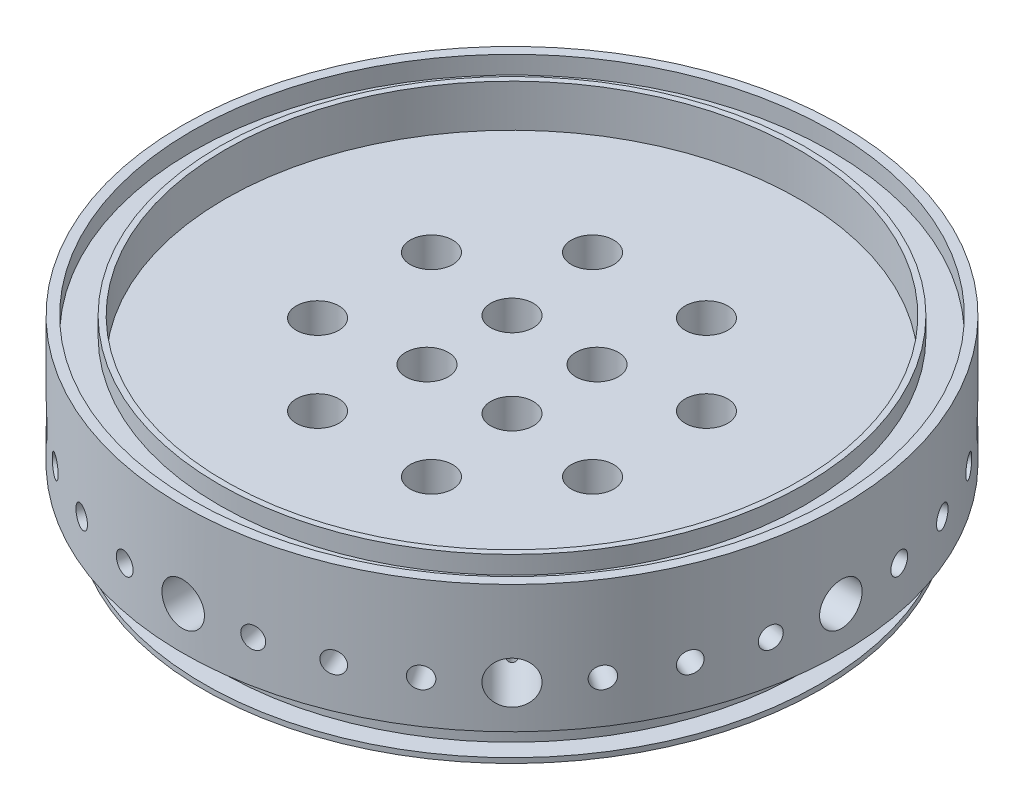
from build123d import *

# Parameters (mm, degrees)
CIRPATTERN9_COUNT  = 32
CIRPATTERN1_COUNT  = 8
CIRPATTERN2_COUNT  = 8
CIRPATTERN3_COUNT  = 4
CIRPATTERN4_COUNT  = 4
CIRPATTERN5_COUNT  = 8
CIRPATTERN6_COUNT  = 32
CIRPATTERN10_COUNT = 8
CIRPATTERN7_COUNT  = 4
CIRPATTERN8_COUNT  = 8


with BuildPart() as part:
    # Sketch1 → Revolve1 (revolve)
    with BuildSketch(Plane.XY):
        Polygon((0, 0), (-46.0375, 0), (-46.0375, 0.75565), (-43.2181, 0.75565), (-43.2181, 5.55625), (-46.0375, 5.55625), (-46.0375, 6.35), (-49.2125, 6.35), (-49.2125, 25.4), (-47.7774, 25.4), (-47.7774, 22.7076), (-43.7134, 22.7076), (-43.7134, 25.4), (-42.8625, 25.4), (-42.8625, 19.05), (0, 19.05), align=None)
    revolve(axis=Axis((0, 19.05, 0), (0, -1, 0)))

    # Sketch37 → 1/8 (0.125) Diameter Hole2 (revolve, cut)
    with BuildSketch(Plane(origin=(49.2125, 12.7, 0), x_dir=(0, 0, -1), z_dir=(0, 1, 0))):
        Polygon((0, 0), (0, 13.653866233), (1.5875, 12.7), (1.5875, 0), align=None)
    f_1_8_0_125_diameter_hole2 = revolve(axis=Axis((55.5625, 12.7, 0), (-1, 0, 0)), mode=Mode.SUBTRACT)

    # CirPattern9: 1/8 (0.125) Diameter Hole2 ×32 about axis
    cirpattern9_axis = Axis((0, -42.3, 0), (0, 1, 0))
    for i in range(1, CIRPATTERN9_COUNT):
        add(f_1_8_0_125_diameter_hole2.rotate(cirpattern9_axis, i * 360 / CIRPATTERN9_COUNT), mode=Mode.SUBTRACT)

    # Sketch13 → 1/4 (0.25) Diameter Hole1 (revolve, cut)
    with BuildSketch(Plane(origin=(49.2125, 12.7, 0), x_dir=(0, 0, -1), z_dir=(0, 1, 0))):
        Polygon((0, 0), (0, 14.607732465), (3.175, 12.7), (3.175, 0), align=None)
    f_1_4_0_25_diameter_hole1 = revolve(axis=Axis((55.5625, 12.7, 0), (-1, 0, 0)), mode=Mode.SUBTRACT)

    # Sketch15 → 3/16 (0.1875) Diameter Hole1 (revolve, cut)
    with BuildSketch(Plane(origin=(49.2125, 12.7, 0), x_dir=(0, 0, -1), z_dir=(0, 1, 0))):
        Polygon((0, 0), (0, 33.180799349), (2.38125, 31.75), (2.38125, 0), align=None)
    f_3_16_0_1875_diameter_hole1 = revolve(axis=Axis((55.5625, 12.7, 0), (-1, 0, 0)), mode=Mode.SUBTRACT)

    # Sketch17 → 1/8 (0.125) Diameter Hole1 (revolve, cut)
    with BuildSketch(Plane(origin=(49.2125, 12.7, 0), x_dir=(0, 0, -1), z_dir=(0, 1, 0))):
        Polygon((0, 0), (0, 45.403866233), (1.5875, 44.45), (1.5875, 0), align=None)
    f_1_8_0_125_diameter_hole1 = revolve(axis=Axis((55.5625, 12.7, 0), (-1, 0, 0)), mode=Mode.SUBTRACT)

    # CirPattern1: 1/4 (0.25) Diameter Hole1 ×8 about axis
    cirpattern1_axis = Axis((0, -42.3, 0), (0, 1, 0))
    for i in range(1, CIRPATTERN1_COUNT):
        add(f_1_4_0_25_diameter_hole1.rotate(cirpattern1_axis, i * 360 / CIRPATTERN1_COUNT), mode=Mode.SUBTRACT)

    # CirPattern2: 3/16 (0.1875) Diameter Hole1 ×8 about axis
    cirpattern2_axis = Axis((0, -42.3, 0), (0, 1, 0))
    for i in range(1, CIRPATTERN2_COUNT):
        add(f_3_16_0_1875_diameter_hole1.rotate(cirpattern2_axis, i * 360 / CIRPATTERN2_COUNT), mode=Mode.SUBTRACT)

    # CirPattern3: 1/8 (0.125) Diameter Hole1 ×4 about axis
    cirpattern3_axis = Axis((0, -42.3, 0), (0, 1, 0))
    for i in range(1, CIRPATTERN3_COUNT):
        add(f_1_8_0_125_diameter_hole1.rotate(cirpattern3_axis, i * 360 / CIRPATTERN3_COUNT), mode=Mode.SUBTRACT)

    # Sketch20 → inner large LOX holes (revolve, cut)
    with BuildSketch(Plane(origin=(-6.35, 19.05, 6.35), x_dir=(0, 0, 1), z_dir=(1, 0, 0))):
        Polygon((0, 0), (0, 14.607732465), (3.175, 12.7), (3.175, 0), align=None)
    inner_large_lox_holes = revolve(axis=Axis((-6.35, 25.4, 6.35), (0, -1, 0)), mode=Mode.SUBTRACT)

    # Sketch22 → outer large LOX hole (revolve, cut)
    with BuildSketch(Plane(origin=(-20.53322261, 19.05, 8.505139284), x_dir=(0, 0, 1), z_dir=(1, 0, 0))):
        Polygon((0, 0), (0, 14.607732465), (3.175, 12.7), (3.175, 0), align=None)
    outer_large_lox_hole = revolve(axis=Axis((-20.53322261, 25.4, 8.505139284), (0, -1, 0)), mode=Mode.SUBTRACT)

    # CirPattern4: inner large LOX holes ×4 about axis
    cirpattern4_axis = Axis((0, -42.3, 0), (0, 1, 0))
    for i in range(1, CIRPATTERN4_COUNT):
        add(inner_large_lox_holes.rotate(cirpattern4_axis, i * 360 / CIRPATTERN4_COUNT), mode=Mode.SUBTRACT)

    # CirPattern5: outer large LOX hole ×8 about axis
    cirpattern5_axis = Axis((0, -42.3, 0), (0, 1, 0))
    for i in range(1, CIRPATTERN5_COUNT):
        add(outer_large_lox_hole.rotate(cirpattern5_axis, i * 360 / CIRPATTERN5_COUNT), mode=Mode.SUBTRACT)

    # Sketch26 → film cooling holes (revolve, cut)
    with BuildSketch(Plane(origin=(-41.413359742, -1.581459083, 0), x_dir=(0.9961946980917455, -0.08715574274765836, 0), z_dir=(0, 0, 1))):
        Polygon((0, 0), (0, 12.871695922), (0.28575, 12.7), (0.28575, 0), align=None)
    film_cooling_holes = revolve(axis=Axis((-41.966798708, -7.907295416, 0), (0.08715574274765835, 0.9961946980917455, 0)), mode=Mode.SUBTRACT)

    # CirPattern6: film cooling holes ×32 about axis
    cirpattern6_axis = Axis((0, -42.3, 0), (0, 1, 0))
    for i in range(1, CIRPATTERN6_COUNT):
        add(film_cooling_holes.rotate(cirpattern6_axis, i * 360 / CIRPATTERN6_COUNT), mode=Mode.SUBTRACT)

    # Sketch39 → 3/64 (0.04688) Diameter Hole1 (revolve, cut)
    with BuildSketch(Plane(origin=(-41.413359742, -1.581459083, 0), x_dir=(0.9961946980917455, -0.08715574274765836, 0), z_dir=(0, 0, 1))):
        Polygon((0, 0), (0, 13.057737992), (0.595376, 12.7), (0.595376, 0), align=None)
    f_3_64_0_04688_diameter_hole1 = revolve(axis=Axis((-41.966798708, -7.907295416, 0), (0.08715574274765835, 0.9961946980917455, 0)), mode=Mode.SUBTRACT)

    # CirPattern10: 3/64 (0.04688) Diameter Hole1 ×8 about axis
    cirpattern10_axis = Axis((0, -42.3, 0), (0, 1, 0))
    for i in range(1, CIRPATTERN10_COUNT):
        add(f_3_64_0_04688_diameter_hole1.rotate(cirpattern10_axis, i * 360 / CIRPATTERN10_COUNT), mode=Mode.SUBTRACT)

    # Sketch28 → 1/16 (0.0625) Diameter Hole2 (revolve, cut)
    with BuildSketch(Plane(origin=(-6.35, 0, 0), x_dir=(0, 0, -1), z_dir=(1, 0, 0))):
        Polygon((0, 0), (0, 13.176933116), (0.79375, 12.7), (0.79375, 0), align=None)
    f_1_16_0_0625_diameter_hole2 = revolve(axis=Axis((-6.35, -6.35, 0), (0, 1, 0)), mode=Mode.SUBTRACT)

    # Sketch30 → 1/16 (0.0625) Diameter Hole1 (revolve, cut)
    with BuildSketch(Plane(origin=(-6.35, -6.35, 0), x_dir=(0, 0.500000000000001, -0.866025403784438), z_dir=(1, 0, 0))):
        Polygon((0, 0), (0, 16.097933116), (0.79375, 15.621), (0.79375, 0), align=None)
    f_1_16_0_0625_diameter_hole1 = revolve(axis=Axis((-6.35, -11.849261314, -3.175), (0, 0.866025403784438, 0.500000000000001)), mode=Mode.SUBTRACT)

    # Sketch33 → 1/16 (0.0625) Diameter Hole3 (revolve, cut)
    with BuildSketch(Plane(origin=(-22.225, 0, 0), x_dir=(0, 0, -1), z_dir=(1, 0, 0))):
        Polygon((0, 0), (0, 13.176933116), (0.79375, 12.7), (0.79375, 0), align=None)
    f_1_16_0_0625_diameter_hole3 = revolve(axis=Axis((-22.225, -6.35, 0), (0, 1, 0)), mode=Mode.SUBTRACT)

    # Sketch35 → 1/16 (0.0625) Diameter Hole4 (revolve, cut)
    with BuildSketch(Plane(origin=(-22.225, -6.35, 0), x_dir=(0, 0.500000000000001, -0.866025403784438), z_dir=(1, 0, 0))):
        Polygon((0, 0), (0, 19.526933116), (0.79375, 19.05), (0.79375, 0), align=None)
    f_1_16_0_0625_diameter_hole4 = revolve(axis=Axis((-22.225, -11.849261314, -3.175), (0, 0.866025403784438, 0.5000000000000009)), mode=Mode.SUBTRACT)

    # Mirror1: 1/16 (0.0625) Diameter Hole1 across plane
    add(f_1_16_0_0625_diameter_hole1.mirror(Plane.XY), mode=Mode.SUBTRACT)

    # Mirror2: 1/16 (0.0625) Diameter Hole4 across plane
    add(f_1_16_0_0625_diameter_hole4.mirror(Plane.XY), mode=Mode.SUBTRACT)

    # CirPattern7: 1/16 (0.0625) Diameter Hole2, 1/16 (0.0625) Diameter Hole1 ×4 about axis
    cirpattern7_axis = Axis((0, -42.3, 0), (0, 1, 0))
    add([f_1_16_0_0625_diameter_hole2.rotate(cirpattern7_axis, i * 360 / CIRPATTERN7_COUNT) for i in range(1, CIRPATTERN7_COUNT)], mode=Mode.SUBTRACT)
    add([f_1_16_0_0625_diameter_hole1.rotate(cirpattern7_axis, i * 360 / CIRPATTERN7_COUNT) for i in range(1, CIRPATTERN7_COUNT)], mode=Mode.SUBTRACT)

    # CirPattern7 copy 1 sketch → CirPattern7 copy 1 (revolve, cut)
    with BuildSketch(Plane(origin=(0, -6.35, 6.35), x_dir=(0.866025403784438, 0.500000000000001, 0), z_dir=(0, 0, -1))):
        Polygon((0, 0), (0, -16.097933116), (0.79375, -15.621), (0.79375, 0), align=None)
    revolve(axis=Axis((3.175, -11.849261314, 6.35), (0.500000000000001, -0.866025403784438, 0)), mode=Mode.SUBTRACT)

    # CirPattern7 copy 2 sketch → CirPattern7 copy 2 (revolve, cut)
    with BuildSketch(Plane(origin=(6.35, -6.35, 0), x_dir=(0, 0.500000000000001, -0.866025403784438), z_dir=(-1, 0, 0))):
        Polygon((0, 0), (0, -16.097933116), (0.79375, -15.621), (0.79375, 0), align=None)
    revolve(axis=Axis((6.35, -11.849261314, -3.175), (0, -0.866025403784438, -0.500000000000001)), mode=Mode.SUBTRACT)

    # CirPattern7 copy 3 sketch → CirPattern7 copy 3 (revolve, cut)
    with BuildSketch(Plane(origin=(0, -6.35, -6.35), x_dir=(-0.866025403784438, 0.500000000000001, 0), z_dir=(0, 0, 1))):
        Polygon((0, 0), (0, -16.097933116), (0.79375, -15.621), (0.79375, 0), align=None)
    revolve(axis=Axis((-3.175, -11.849261314, -6.35), (-0.500000000000001, -0.866025403784438, 0)), mode=Mode.SUBTRACT)

    # CirPattern8: 1/16 (0.0625) Diameter Hole3, 1/16 (0.0625) Diameter Hole4 ×8 about axis
    cirpattern8_axis = Axis((0, -42.3, 0), (0, 1, 0))
    add([f_1_16_0_0625_diameter_hole3.rotate(cirpattern8_axis, i * 360 / CIRPATTERN8_COUNT) for i in range(1, CIRPATTERN8_COUNT)], mode=Mode.SUBTRACT)
    add([f_1_16_0_0625_diameter_hole4.rotate(cirpattern8_axis, i * 360 / CIRPATTERN8_COUNT) for i in range(1, CIRPATTERN8_COUNT)], mode=Mode.SUBTRACT)

    # CirPattern8 copy 1 sketch → CirPattern8 copy 1 (revolve, cut)
    with BuildSketch(Plane(origin=(-15.715448212, -6.35, 15.715448212), x_dir=(0.612372435695794, 0.500000000000001, 0.6123724356957941), z_dir=(0.7071067811865476, 0, -0.7071067811865475))):
        Polygon((0, 0), (0, -19.526933116), (0.79375, -19.05), (0.79375, 0), align=None)
    revolve(axis=Axis((-13.470384182, -11.849261314, 17.960512242), (0.3535533905932744, -0.866025403784438, 0.35355339059327434)), mode=Mode.SUBTRACT)

    # CirPattern8 copy 2 sketch → CirPattern8 copy 2 (revolve, cut)
    with BuildSketch(Plane(origin=(0, -6.35, 22.225), x_dir=(0.866025403784438, 0.500000000000001, 0), z_dir=(0, 0, -1))):
        Polygon((0, 0), (0, -19.526933116), (0.79375, -19.05), (0.79375, 0), align=None)
    revolve(axis=Axis((3.175, -11.849261314, 22.225), (0.5000000000000009, -0.866025403784438, 0)), mode=Mode.SUBTRACT)

    # CirPattern8 copy 3 sketch → CirPattern8 copy 3 (revolve, cut)
    with BuildSketch(Plane(origin=(15.715448212, -6.35, 15.715448212), x_dir=(0.6123724356957941, 0.500000000000001, -0.612372435695794), z_dir=(-0.7071067811865475, 0, -0.7071067811865476))):
        Polygon((0, 0), (0, -19.526933116), (0.79375, -19.05), (0.79375, 0), align=None)
    revolve(axis=Axis((17.960512242, -11.849261314, 13.470384182), (0.35355339059327434, -0.866025403784438, -0.3535533905932744)), mode=Mode.SUBTRACT)

    # CirPattern8 copy 4 sketch → CirPattern8 copy 4 (revolve, cut)
    with BuildSketch(Plane(origin=(22.225, -6.35, 0), x_dir=(0, 0.500000000000001, -0.866025403784438), z_dir=(-1, 0, 0))):
        Polygon((0, 0), (0, -19.526933116), (0.79375, -19.05), (0.79375, 0), align=None)
    revolve(axis=Axis((22.225, -11.849261314, -3.175), (0, -0.866025403784438, -0.5000000000000009)), mode=Mode.SUBTRACT)

    # CirPattern8 copy 5 sketch → CirPattern8 copy 5 (revolve, cut)
    with BuildSketch(Plane(origin=(15.715448212, -6.35, -15.715448212), x_dir=(-0.612372435695794, 0.500000000000001, -0.6123724356957942), z_dir=(-0.7071067811865477, 0, 0.7071067811865475))):
        Polygon((0, 0), (0, -19.526933116), (0.79375, -19.05), (0.79375, 0), align=None)
    revolve(axis=Axis((13.470384182, -11.849261314, -17.960512242), (-0.3535533905932744, -0.866025403784438, -0.3535533905932744)), mode=Mode.SUBTRACT)

    # CirPattern8 copy 6 sketch → CirPattern8 copy 6 (revolve, cut)
    with BuildSketch(Plane(origin=(0, -6.35, -22.225), x_dir=(-0.866025403784438, 0.500000000000001, 0), z_dir=(0, 0, 1))):
        Polygon((0, 0), (0, -19.526933116), (0.79375, -19.05), (0.79375, 0), align=None)
    revolve(axis=Axis((-3.175, -11.849261314, -22.225), (-0.5000000000000009, -0.866025403784438, 0)), mode=Mode.SUBTRACT)

    # CirPattern8 copy 7 sketch → CirPattern8 copy 7 (revolve, cut)
    with BuildSketch(Plane(origin=(-15.715448212, -6.35, -15.715448212), x_dir=(-0.6123724356957942, 0.500000000000001, 0.6123724356957939), z_dir=(0.7071067811865474, 0, 0.7071067811865477))):
        Polygon((0, 0), (0, -19.526933116), (0.79375, -19.05), (0.79375, 0), align=None)
    revolve(axis=Axis((-17.960512242, -11.849261314, -13.470384182), (-0.3535533905932744, -0.866025403784438, 0.35355339059327434)), mode=Mode.SUBTRACT)


solid = part.part
